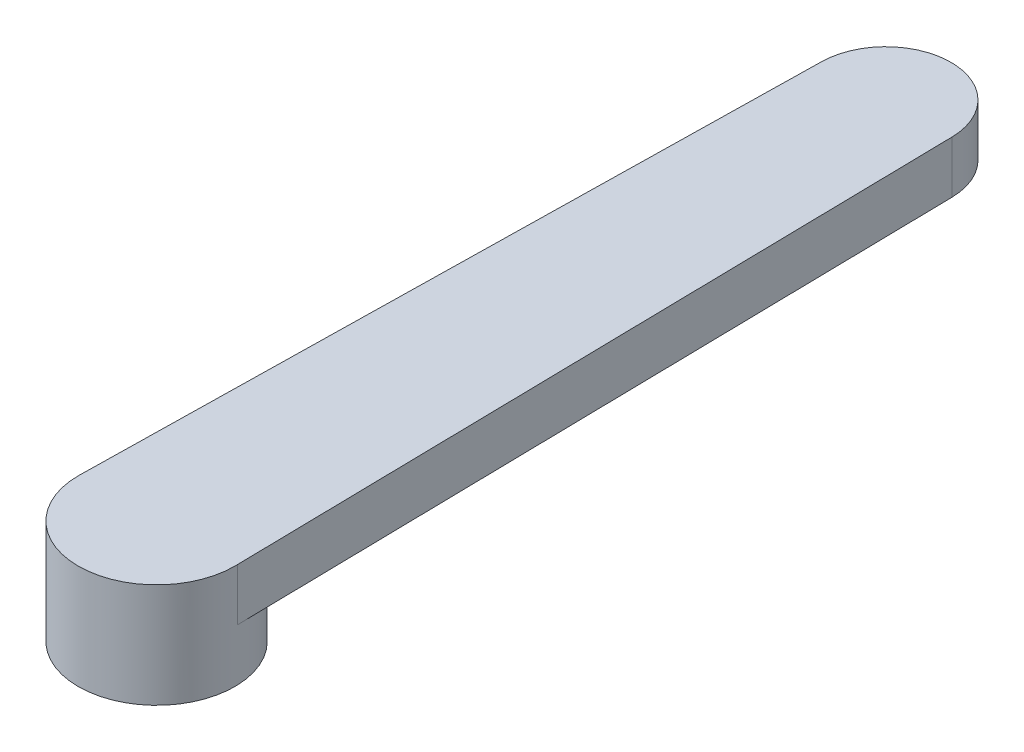
from build123d import *

# Parameters (mm, degrees)
SKETCH1_R           = 3
SKETCH1_R_2         = 2.35
BOSS_EXTRUDE1_DEPTH = 4
BOSS_EXTRUDE2_START = -1
SKETCH2_R           = 3
BOSS_EXTRUDE2_DEPTH = 1
BOSS_EXTRUDE4_START = -2
BOSS_EXTRUDE4_DEPTH = 2


with BuildPart() as part:
    # Sketch1 → Boss-Extrude1 (new body)
    with BuildSketch(Plane(origin=(0, 0, 0), x_dir=(1, 0, 0), z_dir=(0, 1, 0))):
        Circle(SKETCH1_R)
        Circle(SKETCH1_R_2, mode=Mode.SUBTRACT)
    extrude(amount=BOSS_EXTRUDE1_DEPTH)

    # Sketch2 → Boss-Extrude2 (add)
    with BuildSketch(Plane(origin=(0, 4, 0), x_dir=(1, 0, 0), z_dir=(0, 1, 0)).offset(BOSS_EXTRUDE2_START)):
        Circle(SKETCH2_R)
    extrude(amount=BOSS_EXTRUDE2_DEPTH)

    # Sketch3 → Boss-Extrude4 (add)
    with BuildSketch(Plane(origin=(0, 4, 0), x_dir=(1, 0, 0), z_dir=(0, 1, 0)).offset(BOSS_EXTRUDE4_START)):
        with BuildLine():
            Line((-3, 0), (-2.499999999, 27.995535358))
            ThreePointArc((-2.499999999, 27.995535358), (-0.000434213, 30.450892501), (2.499201472, 27.995606519))
            Line((2.499201472, 27.995606519), (3, 0))
            Line((3, 0), (2.35, 0))
            ThreePointArc((2.35, 0), (0, 2.35), (-2.35, 0))
            Line((-2.35, 0), (-3, 0))
        make_face()
    extrude(amount=BOSS_EXTRUDE4_DEPTH)


solid = part.part
